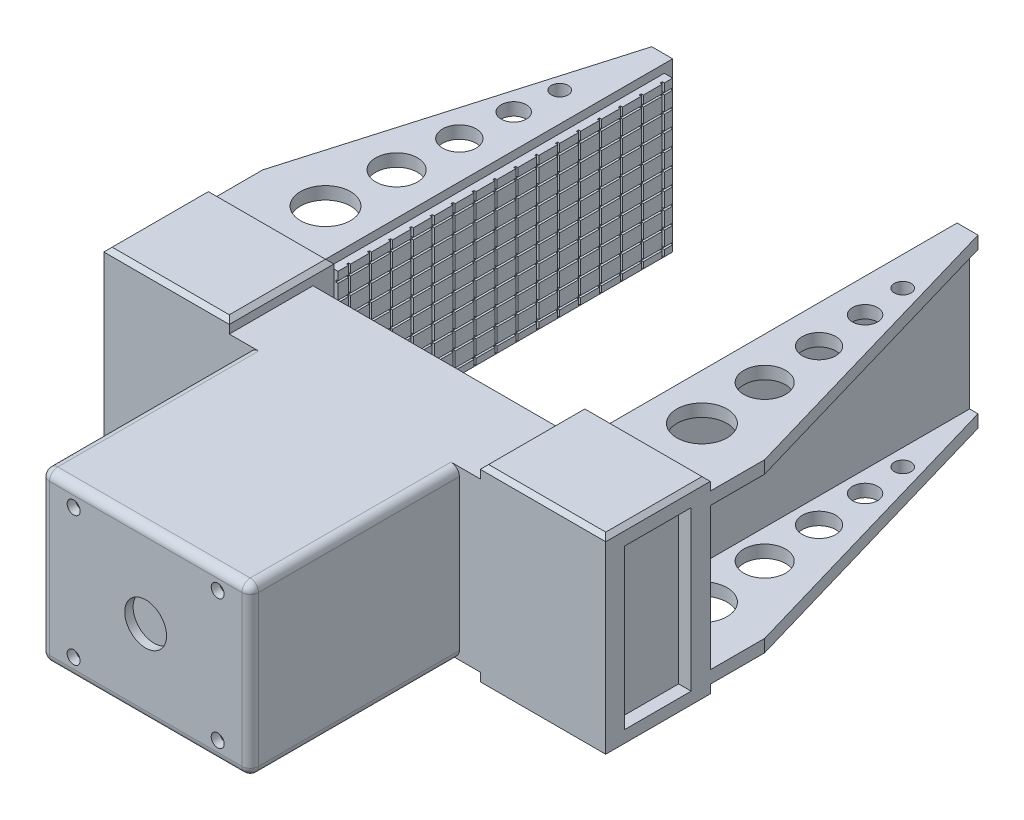
from build123d import *

# Parameters (mm, degrees)
SKETCH1_W               = 50
SKETCH1_H               = 40
BOSS_EXTRUDE2_DEPTH     = 50
SKETCH2_R               = 1.55
SKETCH2_R_2             = 5
CUT_EXTRUDE1_DEPTH      = 2
SKETCH3_W               = 120
SKETCH3_H               = 40
BOSS_EXTRUDE3_DEPTH     = 20
SKETCH4_W               = 26
SKETCH4_H               = 40
BOSS_EXTRUDE4_DEPTH     = 90
SHELL1_T                = -3
CUT_EXTRUDE2_DEPTH      = 173.046505341
CUT_EXTRUDE2_DEPTH_BACK = 173.046505341
SKETCH5_R               = 2
SKETCH5_R_2             = 3
SKETCH5_R_3             = 4
SKETCH5_R_4             = 6
SKETCH5_R_5             = 5
SKETCH7_W               = 80
SKETCH7_H               = 36
BOSS_EXTRUDE6_DEPTH     = 2
SKETCH8_W               = 0.5
SKETCH8_H               = 46.570535603
CUT_EXTRUDE3_DEPTH      = 0.5
LPATTERN1_COUNT         = 16
LPATTERN1_PITCH         = 5
SKETCH9_W               = 90.063809384
SKETCH9_H               = 0.5
CUT_EXTRUDE4_DEPTH      = 0.5
LPATTERN2_COUNT         = 9
LPATTERN2_PITCH         = 4
SKETCH10_W              = 25
SKETCH10_H              = 46
BOSS_EXTRUDE7_DEPTH     = 30
SKETCH11_W              = 16
SKETCH11_H              = 38
CUT_EXTRUDE5_DEPTH      = 3
SKETCH12_W              = 25
SKETCH12_H              = 46
BOSS_EXTRUDE8_DEPTH     = 30
CHAMFER1_SIZE           = 1
FILLET1_R               = 2


with BuildPart() as part:
    # Sketch1 → Boss-Extrude2 (new body)
    with BuildSketch(Plane.XY):
        Rectangle(SKETCH1_W, SKETCH1_H)
    extrude(amount=-BOSS_EXTRUDE2_DEPTH)

    # Sketch2 → Cut-Extrude1 (cut)
    with BuildSketch(Plane.XY):
        with Locations((-17.222222222, -15.5)):
            Circle(SKETCH2_R)
        with Locations((17.222222222, -15.5)):
            Circle(SKETCH2_R)
        Circle(SKETCH2_R_2)
        with Locations((17.222222222, 15.5)):
            Circle(SKETCH2_R)
        with Locations((-17.222222222, 15.5)):
            Circle(SKETCH2_R)
    extrude(amount=-CUT_EXTRUDE1_DEPTH, mode=Mode.SUBTRACT)

    # Sketch3 → Boss-Extrude3 (add)
    with BuildSketch(Plane(origin=(0, 0, -50), x_dir=(-1, 0, 0), z_dir=(0, 0, -1))):
        Rectangle(SKETCH3_W, SKETCH3_H)
    extrude(amount=BOSS_EXTRUDE3_DEPTH)



with BuildPart() as body_2:
    # Sketch4 → Boss-Extrude4 (new body)
    with BuildSketch(Plane(origin=(0, 0, -70), x_dir=(-1, 0, 0), z_dir=(0, 0, -1))):
        with Locations((-47, 0)):
            Rectangle(SKETCH4_W, SKETCH4_H)
    extrude(amount=BOSS_EXTRUDE4_DEPTH)

    # Shell1
    shell1_openings = [body_2.faces().sort_by_distance(p)[0] for p in [
        (47, 0, -160),
        (60, 0, -115),
    ]]
    offset(amount=SHELL1_T, openings=shell1_openings, kind=Kind.INTERSECTION)

    # Sketch5 → Cut-Extrude2 (cut, two sides: drawn at the far end of the back side and taken through both)
    with BuildSketch(Plane(origin=(0, 0, 0), x_dir=(1, 0, 0), z_dir=(0, 1, 0)).offset(-CUT_EXTRUDE2_DEPTH_BACK)):
        with Locations(Location((41, 140, 0), (0, 0, 270))):
            Circle(SKETCH5_R)
        with Locations(Location((42, 130, 0), (0, 0, 270))):
            Circle(SKETCH5_R_2)
        with Locations(Location((43, 118, 0), (0, 0, 270))):
            Circle(SKETCH5_R_3)
        with Locations(Location((45, 88, 0), (0, 0, 270))):
            Circle(SKETCH5_R_4)
        with Locations(Location((44, 104, 0), (0, 0, 270))):
            Circle(SKETCH5_R_5)
        Polygon((39, 160), (60, 88), (60, 160), align=None)
    extrude(amount=CUT_EXTRUDE2_DEPTH + CUT_EXTRUDE2_DEPTH_BACK, mode=Mode.SUBTRACT)


with BuildPart() as body_3:
    # Mirror3: mirrored copy
    add(body_2.part.mirror(Plane(origin=(0, 0, 0), x_dir=(0, 0, 1), z_dir=(1, 0, 0))))


with BuildPart() as body_4:
    # Sketch7 → Boss-Extrude6 (new body)
    with BuildSketch(Plane.ZY.offset(-34)):
        with Locations((-118, 0)):
            Rectangle(SKETCH7_W, SKETCH7_H)
    extrude(amount=BOSS_EXTRUDE6_DEPTH)

    # Sketch8 → Cut-Extrude3 (cut)
    with BuildSketch(Plane.ZY.offset(-32)):
        with Locations((-155.75, -0.317661498)):
            Rectangle(SKETCH8_W, SKETCH8_H)
    cut_extrude3 = extrude(amount=-CUT_EXTRUDE3_DEPTH, mode=Mode.SUBTRACT)

    # LPattern1: Cut-Extrude3 ×16
    with Locations(*[(0, 0, i * LPATTERN1_PITCH) for i in range(1, LPATTERN1_COUNT)]):
        add(cut_extrude3, mode=Mode.SUBTRACT)

    # Sketch9 → Cut-Extrude4 (cut)
    with BuildSketch(Plane.ZY.offset(-32)):
        with Locations((-119.11458886, 15.75)):
            Rectangle(SKETCH9_W, SKETCH9_H)
    cut_extrude4 = extrude(amount=-CUT_EXTRUDE4_DEPTH, mode=Mode.SUBTRACT)

    # LPattern2: Cut-Extrude4 ×9
    with Locations(*[(0, -i * LPATTERN2_PITCH, 0) for i in range(1, LPATTERN2_COUNT)]):
        add(cut_extrude4, mode=Mode.SUBTRACT)


with BuildPart() as body_5:
    # Mirror4: mirrored copy
    add(body_4.part.mirror(Plane(origin=(0, 0, 0), x_dir=(0, 0, 1), z_dir=(1, 0, 0))))


with BuildPart() as part_1:
    add(part.part)

    add(body_2.part)  # Boss-Extrude7 merges body 2
    # Sketch10 → Boss-Extrude7 (add)
    with BuildSketch(Plane(origin=(60, 0, 0), x_dir=(0, 0, -1), z_dir=(1, 0, 0))):
        with Locations((62.5, 0)):
            Rectangle(SKETCH10_W, SKETCH10_H)
    extrude(amount=-BOSS_EXTRUDE7_DEPTH)

    # Sketch11 → Cut-Extrude5 (cut)
    with BuildSketch(Plane(origin=(60, 0, 0), x_dir=(0, 0, -1), z_dir=(1, 0, 0))):
        with Locations((62.426776557, -0.146446885)):
            Rectangle(SKETCH11_W, SKETCH11_H)
    cut_extrude5 = extrude(amount=-CUT_EXTRUDE5_DEPTH, mode=Mode.SUBTRACT)


    add(body_3.part)  # Boss-Extrude8 merges body 3
    # Sketch12 → Boss-Extrude8 (add)
    with BuildSketch(Plane.ZY.offset(60)):
        with Locations((-62.5, 0)):
            Rectangle(SKETCH12_W, SKETCH12_H)
    extrude(amount=-BOSS_EXTRUDE8_DEPTH)

    # Mirror11: Cut-Extrude5 across plane
    add(cut_extrude5.mirror(Plane(origin=(0, 0, 0), x_dir=(0, 0, 1), z_dir=(1, 0, 0))), mode=Mode.SUBTRACT)

    # Chamfer1
    chamfer1_edges = [part_1.edges().sort_by_distance(p)[0] for p in [
        (-45, -23, -75),
        (-60, -23, -62.5),
        (-60, 23, -62.5),
        (-30, 23, -62.5),
        (-45, 23, -75),
        (-45, 23, -50),
        (-30, -23, -62.5),
        (-45, -23, -50),
        (45, 23, -75),
        (45, -23, -50),
        (60, 23, -62.5),
        (60, -23, -62.5),
        (30, 23, -62.5),
        (45, 23, -50),
        (30, -23, -62.5),
        (45, -23, -75),
    ]]
    chamfer(chamfer1_edges, length=CHAMFER1_SIZE)

    # Fillet1
    fillet1_edges = [part_1.edges().sort_by_distance(p)[0] for p in [
        (-25, 20, -25),
        (0, 20, 0),
        (25, -20, -25),
        (25, 20, -25),
        (-25, 0, 0),
        (-25, -20, -25),
        (0, -20, 0),
        (25, 0, 0),
    ]]
    fillet(fillet1_edges, radius=FILLET1_R)


solid = Compound([body_4.part, body_5.part, part_1.part])
